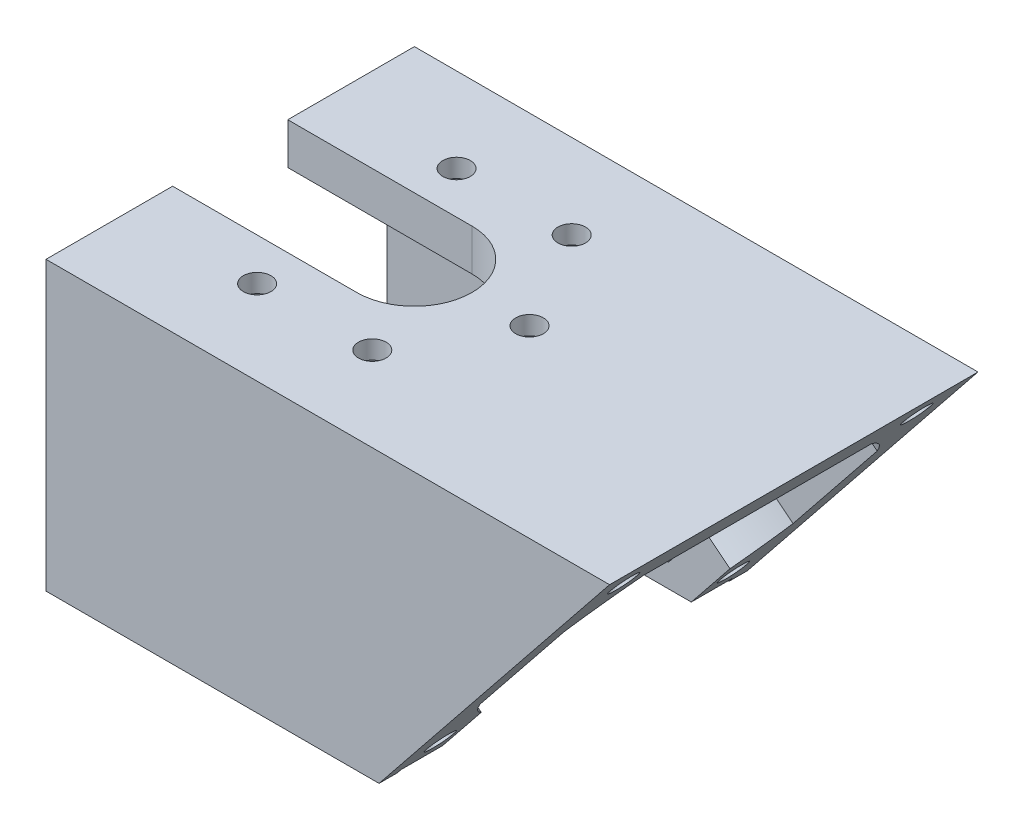
from build123d import *

# Parameters (mm, degrees)
BOSS_EXTRUDE1_DEPTH            = 20
BOSS_EXTRUDE1_DEPTH_BACK       = 20
CUT_EXTRUDE1_REACH             = 75.759
SKETCH3_W                      = 34
SKETCH3_H                      = 25.2
CUT_EXTRUDE2_DEPTH             = 3
CUT_EXTRUDE3_REACH             = 57.409
CUT_EXTRUDE4_REACH             = 57.409
SKETCH7_R                      = 1.5
SKETCH6_R                      = 1.5
BOSS_EXTRUDE2_DEPTH            = 1.5
CHAMFER3_SIZE                  = 1.5
CUT_EXTRUDE5_DEPTH             = 2.5
CUT_EXTRUDE6_REACH             = 55.777
SKETCH9_W                      = 44.905987645
SKETCH9_H                      = 27
CUT_EXTRUDE6_DIRECTION_2_REACH = 55.777
BOSS_EXTRUDE3_REACH            = 53.8
CHAMFER1_SIZE                  = 4
CHAMFER2_SIZE                  = 3.5
SKETCH11_W                     = 40.505645026
SKETCH11_H                     = 4.5
CUT_EXTRUDE7_DEPTH             = 0.5
SKETCH13_R                     = 1.5
CUT_EXTRUDE8_DEPTH             = 3.15


# Some blends are built 0.0001 mm under size
with BuildPart() as part:
    # Sketch1 → Boss-Extrude1 (new, two sides: drawn at the far end of the back side and taken through both)
    with BuildSketch(Plane.XY.offset(-BOSS_EXTRUDE1_DEPTH_BACK)):
        Polygon((-20, -4.8), (41.191180555, -4.8), (16.16, -36), (-20, -36), align=None)
    extrude(amount=BOSS_EXTRUDE1_DEPTH + BOSS_EXTRUDE1_DEPTH_BACK)

    # Cut-Extrude1: up to this plane
    cut_extrude1_end = Plane(origin=(38.851180555, -2.922661458, -20), z_dir=(0.7799999999999999, -0.6257795138864808, 0))
    # Sketch3 → Cut-Extrude1 (cut, up to the surface)
    with BuildSketch(Plane.ZY.offset(20), mode=Mode.PRIVATE) as cut_extrude1_sk1:
        with Locations((0, -20.4)):
            Rectangle(SKETCH3_W, SKETCH3_H)
    cut_extrude1_tool1 = split(extrude(cut_extrude1_sk1.sketch, amount=-CUT_EXTRUDE1_REACH, mode=Mode.PRIVATE), bisect_by=cut_extrude1_end, keep=Keep.BOTH, mode=Mode.PRIVATE)
    add(cut_extrude1_tool1.solids().sort_by_distance((-20, -20.4, 0))[0], mode=Mode.SUBTRACT)

    # Sketch4 → Cut-Extrude2 (cut)
    with BuildSketch(Plane(origin=(25.06363275, -20.108087075, 0), x_dir=(0, 0, 1), z_dir=(-0.78, 0.6257795138864807, 0))):
        with BuildLine():
            Line((-17, 9.329856704), (-17, -5.264662815))
            ThreePointArc((-17, -5.264662815), (0, -16.467403056), (17, -5.264662815))
            Line((17, -5.264662815), (17, 9.329856704))
            ThreePointArc((17, 9.329856704), (15.039919545, 12.805285563), (12.38022373, 15.779598814))
            Line((12.38022373, 15.779598814), (-12.38022373, 15.779598814))
            ThreePointArc((-12.38022373, 15.779598814), (-15.039919545, 12.805285563), (-17, 9.329856704))
        make_face()
    extrude(amount=-CUT_EXTRUDE2_DEPTH, mode=Mode.SUBTRACT)

    # Sketch5 → Cut-Extrude3 (cut, up to next)
    with BuildSketch(Plane(origin=(0, -4.8, 0), x_dir=(1, 0, 0), z_dir=(0, 1, 0)), mode=Mode.PRIVATE) as cut_extrude3_sk1:
        with BuildLine():
            Line((0, 6.25), (-20, 6.25))
            Line((-20, 6.25), (-20, -6.25))
            Line((-20, -6.25), (0, -6.25))
            ThreePointArc((0, -6.25), (6.25, 0), (0, 6.25))
        make_face()
    cut_extrude3_tool1 = extrude(cut_extrude3_sk1.sketch, amount=-CUT_EXTRUDE3_REACH, mode=Mode.PRIVATE) & part.part
    add(cut_extrude3_tool1.solids().sort_by_distance((-7.506569, -4.8, 0))[0], mode=Mode.SUBTRACT)

    # Cut-Extrude4: up to this face of the body (flat: up to its plane)
    cut_extrude4_end = Plane(part.part.faces().sort_by_distance((-1.92, -36, 0))[0])
    # Sketch7 → Cut-Extrude4 (cut, up to the picked face)
    with BuildSketch(Plane(origin=(0, -4.8, 0), x_dir=(1, 0, 0), z_dir=(0, 1, 0)), mode=Mode.PRIVATE) as cut_extrude4_sk1:
        with Locations(Location((12.5, 0, 0), (0, 0, 180))):
            Circle(SKETCH7_R)
    cut_extrude4_tool1 = split(extrude(cut_extrude4_sk1.sketch, amount=-CUT_EXTRUDE4_REACH, mode=Mode.PRIVATE), bisect_by=cut_extrude4_end, keep=Keep.BOTH, mode=Mode.PRIVATE)
    # Sketch7 → Cut-Extrude4 (cut, up to the picked face)
    with BuildSketch(Plane(origin=(0, -4.8, 0), x_dir=(1, 0, 0), z_dir=(0, 1, 0)), mode=Mode.PRIVATE) as cut_extrude4_sk2:
        with Locations(Location((6.25, -10.825317547, 0), (0, 0, 180))):
            Circle(SKETCH7_R)
    cut_extrude4_tool2 = split(extrude(cut_extrude4_sk2.sketch, amount=-CUT_EXTRUDE4_REACH, mode=Mode.PRIVATE), bisect_by=cut_extrude4_end, keep=Keep.BOTH, mode=Mode.PRIVATE)
    # Sketch7 → Cut-Extrude4 (cut, up to the picked face)
    with BuildSketch(Plane(origin=(0, -4.8, 0), x_dir=(1, 0, 0), z_dir=(0, 1, 0)), mode=Mode.PRIVATE) as cut_extrude4_sk3:
        with Locations(Location((-6.25, -10.825317547, 0), (0, 0, 180))):
            Circle(SKETCH7_R)
    cut_extrude4_tool3 = split(extrude(cut_extrude4_sk3.sketch, amount=-CUT_EXTRUDE4_REACH, mode=Mode.PRIVATE), bisect_by=cut_extrude4_end, keep=Keep.BOTH, mode=Mode.PRIVATE)
    # Sketch7 → Cut-Extrude4 (cut, up to the picked face)
    with BuildSketch(Plane(origin=(0, -4.8, 0), x_dir=(1, 0, 0), z_dir=(0, 1, 0)), mode=Mode.PRIVATE) as cut_extrude4_sk4:
        with Locations((-12.5, 0)):
            Circle(SKETCH7_R)
    cut_extrude4_tool4 = split(extrude(cut_extrude4_sk4.sketch, amount=-CUT_EXTRUDE4_REACH, mode=Mode.PRIVATE), bisect_by=cut_extrude4_end, keep=Keep.BOTH, mode=Mode.PRIVATE)
    # Sketch7 → Cut-Extrude4 (cut, up to the picked face)
    with BuildSketch(Plane(origin=(0, -4.8, 0), x_dir=(1, 0, 0), z_dir=(0, 1, 0)), mode=Mode.PRIVATE) as cut_extrude4_sk5:
        with Locations(Location((-6.25, 10.825317547, 0), (0, 0, 180))):
            Circle(SKETCH7_R)
    cut_extrude4_tool5 = split(extrude(cut_extrude4_sk5.sketch, amount=-CUT_EXTRUDE4_REACH, mode=Mode.PRIVATE), bisect_by=cut_extrude4_end, keep=Keep.BOTH, mode=Mode.PRIVATE)
    # Sketch7 → Cut-Extrude4 (cut, up to the picked face)
    with BuildSketch(Plane(origin=(0, -4.8, 0), x_dir=(1, 0, 0), z_dir=(0, 1, 0)), mode=Mode.PRIVATE) as cut_extrude4_sk6:
        with Locations(Location((6.25, 10.825317547, 0), (0, 0, 180))):
            Circle(SKETCH7_R)
    cut_extrude4_tool6 = split(extrude(cut_extrude4_sk6.sketch, amount=-CUT_EXTRUDE4_REACH, mode=Mode.PRIVATE), bisect_by=cut_extrude4_end, keep=Keep.BOTH, mode=Mode.PRIVATE)
    add(cut_extrude4_tool1.solids().sort_by(Axis((12.5, -4.8, 0), (0, -1, 0)))[0], mode=Mode.SUBTRACT)
    add(cut_extrude4_tool2.solids().sort_by(Axis((6.25, -4.8, 10.825318), (0, -1, 0)))[0], mode=Mode.SUBTRACT)
    add(cut_extrude4_tool3.solids().sort_by(Axis((-6.25, -4.8, 10.825318), (0, -1, 0)))[0], mode=Mode.SUBTRACT)
    add(cut_extrude4_tool4.solids().sort_by(Axis((-12.5, -4.8, 0), (0, -1, 0)))[0], mode=Mode.SUBTRACT)
    add(cut_extrude4_tool5.solids().sort_by(Axis((-6.25, -4.8, -10.825318), (0, -1, 0)))[0], mode=Mode.SUBTRACT)
    add(cut_extrude4_tool6.solids().sort_by(Axis((6.25, -4.8, -10.825318), (0, -1, 0)))[0], mode=Mode.SUBTRACT)

    # Sketch6 → Boss-Extrude2 (add)
    with BuildSketch(Plane.XZ.offset(7.8)):
        with BuildLine():
            Line((0, 6.25), (-17.209749811, 6.25))
            Line((-17.209749811, 6.25), (-20, 6.25))
            Line((-20, 6.25), (-20, 18.309505416))
            Line((-20, 18.309505416), (0, 18.309505416))
            ThreePointArc((0, 18.309505416), (18.309505416, 0), (0, -18.309505416))
            Line((0, -18.309505416), (-20, -18.309505416))
            Line((-20, -18.309505416), (-20, -6.25))
            Line((-20, -6.25), (-17.209749811, -6.25))
            Line((-17.209749811, -6.25), (0, -6.25))
            ThreePointArc((0, -6.25), (6.25, 0), (0, 6.25))
        make_face()
        with Locations(Location((-6.25, 10.825317547, 0), (0, 0, 180))):
            Circle(SKETCH6_R, mode=Mode.SUBTRACT)
        with Locations(Location((6.25, 10.825317547, 0), (0, 0, 180))):
            Circle(SKETCH6_R, mode=Mode.SUBTRACT)
        with Locations(Location((12.5, 0, 0), (0, 0, 180))):
            Circle(SKETCH6_R, mode=Mode.SUBTRACT)
        with Locations(Location((6.25, -10.825317547, 0), (0, 0, 180))):
            Circle(SKETCH6_R, mode=Mode.SUBTRACT)
        with Locations(Location((-6.25, -10.825317547, 0), (0, 0, 180))):
            Circle(SKETCH6_R, mode=Mode.SUBTRACT)
    extrude(amount=BOSS_EXTRUDE2_DEPTH)

    # Chamfer3
    chamfer3_edges = [part.edges().sort_by_distance(p)[0] for p in [
        (18.309505416, -7.8, 0),
    ]]
    chamfer(chamfer3_edges, length=CHAMFER3_SIZE - 0.0001)  # a hair under: the kernel refuses the full size

    # Sketch8 → Cut-Extrude5 (cut)
    with BuildSketch(Plane.XZ.offset(9.3)):
        Polygon((12.5, 3.175426481), (9.75, 1.58771324), (9.75, -1.58771324), (12.5, -3.175426481), (15.25, -1.58771324), (15.25, 1.58771324), align=None)
        Polygon((9.425426481, 10.825317547), (7.83771324, 13.575317547), (4.66228676, 13.575317547), (3.074573519, 10.825317547), (4.66228676, 8.075317547), (7.83771324, 8.075317547), align=None)
        Polygon((-3.074573519, 10.825317547), (-4.66228676, 13.575317547), (-7.83771324, 13.575317547), (-9.425426481, 10.825317547), (-7.83771324, 8.075317547), (-4.66228676, 8.075317547), align=None)
        Polygon((-3.074573519, -10.825317547), (-4.66228676, -8.075317547), (-7.83771324, -8.075317547), (-9.425426481, -10.825317547), (-7.83771324, -13.575317547), (-4.66228676, -13.575317547), align=None)
        Polygon((9.425426481, -10.825317547), (7.83771324, -8.075317547), (4.66228676, -8.075317547), (3.074573519, -10.825317547), (4.66228676, -13.575317547), (7.83771324, -13.575317547), align=None)
    extrude(amount=-CUT_EXTRUDE5_DEPTH, mode=Mode.SUBTRACT)

    # Sketch9 → Cut-Extrude6 (cut, up to next)
    with BuildSketch(Plane(origin=(0, -33, 0), x_dir=(1, 0, 0), z_dir=(0, 1, 0)), mode=Mode.PRIVATE) as cut_extrude6_sk1:
        with Locations((2.452993823, 0)):
            Rectangle(SKETCH9_W, SKETCH9_H)
    cut_extrude6_tool1 = extrude(cut_extrude6_sk1.sketch, amount=-CUT_EXTRUDE6_REACH, mode=Mode.PRIVATE) & part.part
    add(cut_extrude6_tool1.solids().sort_by_distance((2.452994, -33, 0))[0], mode=Mode.SUBTRACT)

    # Sketch9 → Cut-Extrude6 direction 2 (cut, up to next)
    with BuildSketch(Plane(origin=(0, -33, 0), x_dir=(1, 0, 0), z_dir=(0, 1, 0)), mode=Mode.PRIVATE) as cut_extrude6_direction_2_sk1:
        with Locations((2.452993823, 0)):
            Rectangle(SKETCH9_W, SKETCH9_H)
    cut_extrude6_direction_2_tool1 = extrude(cut_extrude6_direction_2_sk1.sketch, amount=CUT_EXTRUDE6_DIRECTION_2_REACH, mode=Mode.PRIVATE) & part.part
    add(cut_extrude6_direction_2_tool1.solids().sort_by_distance((2.452994, -33, 0))[0], mode=Mode.SUBTRACT)

    # Sketch10 → Boss-Extrude3 (add, up to next)
    with BuildSketch(Plane(origin=(25.06363275, -20.108087075, 0), x_dir=(0, 0, 1), z_dir=(-0.78, 0.6257795138864807, 0)), mode=Mode.PRIVATE) as boss_extrude3_sk1:
        with BuildLine():
            Line((17, 9.329856704), (17, 15.779598814))
            Line((17, 15.779598814), (12.38022373, 15.779598814))
            ThreePointArc((12.38022373, 15.779598814), (15.039919545, 12.805285563), (17, 9.329856704))
        make_face()
    boss_extrude3_tool1 = extrude(boss_extrude3_sk1.sketch, amount=BOSS_EXTRUDE3_REACH, mode=Mode.PRIVATE) - part.part
    # Sketch10 → Boss-Extrude3 (add, up to next)
    with BuildSketch(Plane(origin=(25.06363275, -20.108087075, 0), x_dir=(0, 0, 1), z_dir=(-0.78, 0.6257795138864807, 0)), mode=Mode.PRIVATE) as boss_extrude3_sk2:
        with BuildLine():
            Line((-12.38022373, 15.779598814), (-17, 15.779598814))
            Line((-17, 15.779598814), (-17, 9.329856704))
            ThreePointArc((-17, 9.329856704), (-15.039919545, 12.805285563), (-12.38022373, 15.779598814))
        make_face()
    boss_extrude3_tool2 = extrude(boss_extrude3_sk2.sketch, amount=BOSS_EXTRUDE3_REACH, mode=Mode.PRIVATE) - part.part
    add(boss_extrude3_tool1.solids().sort_by_distance((33.70308, -9.339488, 15.573959))[0])
    add(boss_extrude3_tool2.solids().sort_by_distance((33.70308, -9.339488, -15.573959))[0])

    # Chamfer1
    # the kernel refuses this chamfer: 4 mm, written as the material it adds along each edge
    with BuildSketch(Plane(origin=(28.206340733, -16.190873148, -17), x_dir=(-0.7797050951908114, 0.6255429172350234, -0.02749587661058647), z_dir=(-0.6257795138864808, -0.7799999999999999, 0))) as chamfer1_piece_1_section:
        Polygon((CHAMFER1_SIZE * 0.999621916911, -CHAMFER1_SIZE * 0.0274958766106), (-CHAMFER1_SIZE * 0.0274958766106, -CHAMFER1_SIZE * 0.999621916911), (0, 0), align=None)
    chamfer1_piece_1 = extrude(amount=31.836894582, mode=Mode.PRIVATE)
    chamfer1_piece_1 = split(chamfer1_piece_1, bisect_by=Plane(origin=(16.061091739, -28.954015424, -13.5), z_dir=(0, 0, -1)), keep=Keep.TOP, mode=Mode.PRIVATE)
    chamfer1_piece_1 = split(chamfer1_piece_1, bisect_by=Plane(origin=(16.061091739, -33, -15.864251998), z_dir=(0, 1, 0)), keep=Keep.TOP, mode=Mode.PRIVATE)
    chamfer1_piece_1 = chamfer1_piece_1 - Plane(origin=(25.176212906, -17.592514525, 0), x_dir=(-0.24683652243813084, -0.30766824932634074, -0.9189189189189191), z_dir=(-0.78, 0.6257795138864807, 0)) * Cylinder(18.5, 80, mode=Mode.PRIVATE)
    add(chamfer1_piece_1)
    with BuildSketch(Plane(origin=(8.283464318, -41.023650922, 17), x_dir=(-0.7797050951908113, 0.6255429172350233, 0.02749587661058642), z_dir=(0.6257795138864808, 0.7799999999999999, 0))) as chamfer1_piece_2_section:
        Polygon((CHAMFER1_SIZE * 0.999621916911, -CHAMFER1_SIZE * 0.0274958766106), (-CHAMFER1_SIZE * 0.0274958766106, -CHAMFER1_SIZE * 0.999621916911), (0, 0), align=None)
    chamfer1_piece_2 = extrude(amount=31.836894582, mode=Mode.PRIVATE)
    chamfer1_piece_2 = split(chamfer1_piece_2, bisect_by=Plane(origin=(16.061091739, -28.954015425, 13.5), z_dir=(0, 0, 1)), keep=Keep.TOP, mode=Mode.PRIVATE)
    chamfer1_piece_2 = chamfer1_piece_2 - Plane(origin=(25.176212906, -17.592514525, 0), x_dir=(-0.24683652243813084, -0.30766824932634074, -0.9189189189189191), z_dir=(-0.78, 0.6257795138864807, 0)) * Cylinder(18.5, 80, mode=Mode.PRIVATE)
    chamfer1_piece_2 = split(chamfer1_piece_2, bisect_by=Plane(origin=(16.061091739, -33, 15.864251998), z_dir=(0, 1, 0)), keep=Keep.TOP, mode=Mode.PRIVATE)
    add(chamfer1_piece_2)

    # Chamfer2
    chamfer2_edges = [part.edges().sort_by_distance(p)[0] for p in [
        (-5.203757345, -33, -17),
        (-5.203757345, -33, 17),
    ]]
    chamfer(chamfer2_edges, length=CHAMFER2_SIZE - 0.0001)  # a hair under: the kernel refuses the full size

    # Sketch11 → Cut-Extrude7 (cut)
    with BuildSketch(Plane.XZ.offset(36)):
        with Locations((0.252822513, 15.75)):
            Rectangle(SKETCH11_W, SKETCH11_H)
        with Locations((0.252822513, -15.75)):
            Rectangle(SKETCH11_W, SKETCH11_H)
    extrude(amount=-CUT_EXTRUDE7_DEPTH, mode=Mode.SUBTRACT)

    # Sketch13 → Cut-Extrude8 (cut)
    with BuildSketch(Plane(origin=(27.40363275, -21.985425617, 0), x_dir=(0, 0, -1), z_dir=(0.7799999999999998, -0.6257795138864808, 0))):
        with Locations(Location((-15.909902577, 17.942499521, 0), (0, 0, 90))):
            Circle(SKETCH13_R)
        with Locations(Location((15.909902577, 17.942499521, 0), (0, 0, 90))):
            Circle(SKETCH13_R)
        with Locations(Location((15.909902577, -13.877305632, 0), (0, 0, 90))):
            Circle(SKETCH13_R)
        with Locations(Location((-15.909902577, -13.877305632, 0), (0, 0, 90))):
            Circle(SKETCH13_R)
    extrude(amount=-CUT_EXTRUDE8_DEPTH, mode=Mode.SUBTRACT)


solid = part.part
